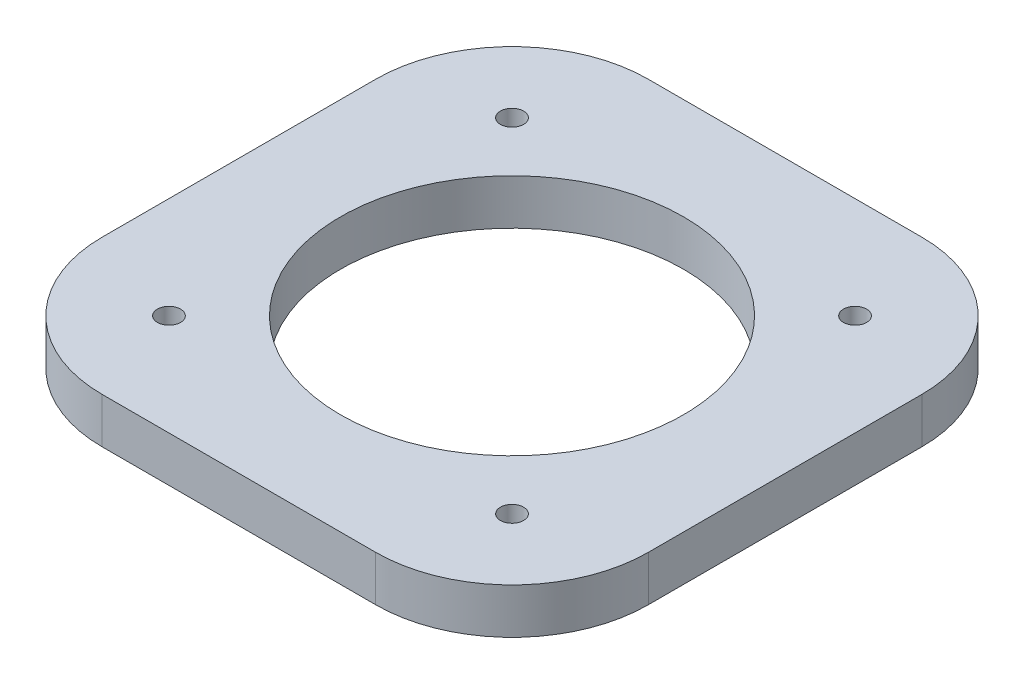
from build123d import *

# Parameters (mm, degrees)
SKETCH1_R           = 2.55
SKETCH1_R_2         = 37.759502115
BOSS_EXTRUDE1_DEPTH = 10


with BuildPart() as part:
    # Sketch1 → Boss-Extrude1 (new body)
    with BuildSketch(Plane(origin=(0, 0, 0), x_dir=(1, 0, 0), z_dir=(0, 1, 0))):
        with BuildLine():
            Line((-30.104076401, 60.104076401), (30.104076401, 60.104076401))
            ThreePointArc((30.104076401, 60.104076401), (51.317279836, 51.317279836), (60.104076401, 30.104076401))
            Line((60.104076401, 30.104076401), (60.104076401, -30.104076401))
            ThreePointArc((60.104076401, -30.104076401), (51.317279836, -51.317279836), (30.104076401, -60.104076401))
            Line((30.104076401, -60.104076401), (-30.104076401, -60.104076401))
            ThreePointArc((-30.104076401, -60.104076401), (-51.317279836, -51.317279836), (-60.104076401, -30.104076401))
            Line((-60.104076401, -30.104076401), (-60.104076401, 30.104076401))
            ThreePointArc((-60.104076401, 30.104076401), (-51.317279836, 51.317279836), (-30.104076401, 60.104076401))
        make_face()
        with Locations((37.759502115, 37.759502115)):
            Circle(SKETCH1_R, mode=Mode.SUBTRACT)
        with Locations((37.759502115, -37.759502115)):
            Circle(SKETCH1_R, mode=Mode.SUBTRACT)
        with Locations((-37.759502115, -37.759502115)):
            Circle(SKETCH1_R, mode=Mode.SUBTRACT)
        with Locations((-37.759502115, 37.759502115)):
            Circle(SKETCH1_R, mode=Mode.SUBTRACT)
        Circle(SKETCH1_R_2, mode=Mode.SUBTRACT)
    extrude(amount=BOSS_EXTRUDE1_DEPTH)


solid = part.part
